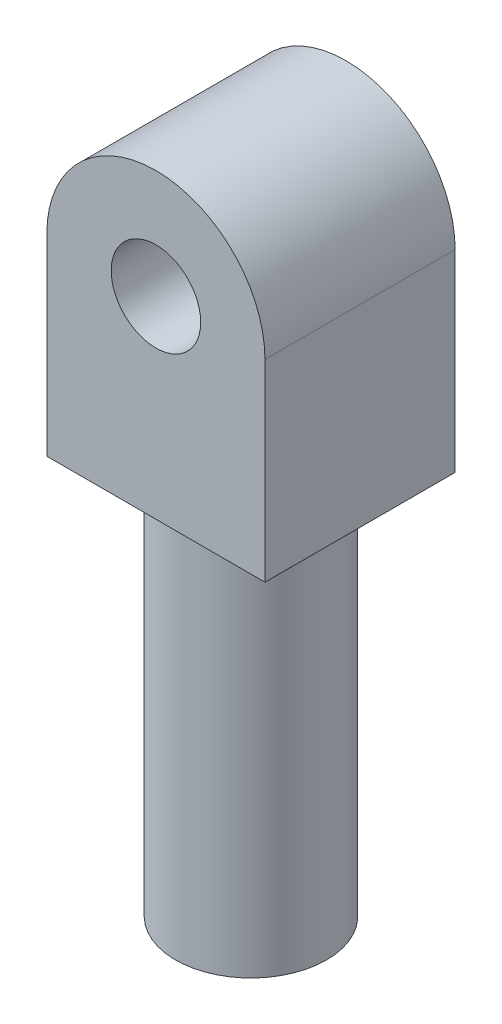
from build123d import *

# Parameters (mm, degrees)
SKETCH1_R           = 4
BOSS_EXTRUDE2_DEPTH = 17
SKETCH2_R           = 6.75
BOSS_EXTRUDE3_DEPTH = 35


with BuildPart() as part:
    # Sketch1 → Boss-Extrude2 (new body)
    with BuildSketch(Plane.XY):
        with BuildLine():
            Line((-9.75, 0), (-9.75, -17.25))
            Line((-9.75, -17.25), (9.75, -17.25))
            Line((9.75, -17.25), (9.75, 0))
            ThreePointArc((9.75, 0), (0, 9.75), (-9.75, 0))
        make_face()
        Circle(SKETCH1_R, mode=Mode.SUBTRACT)
    extrude(amount=BOSS_EXTRUDE2_DEPTH)

    # Sketch2 → Boss-Extrude3 (add)
    with BuildSketch(Plane.XZ.offset(17.25)):
        with Locations((0, 8.5)):
            Circle(SKETCH2_R)
    extrude(amount=BOSS_EXTRUDE3_DEPTH)


solid = part.part
